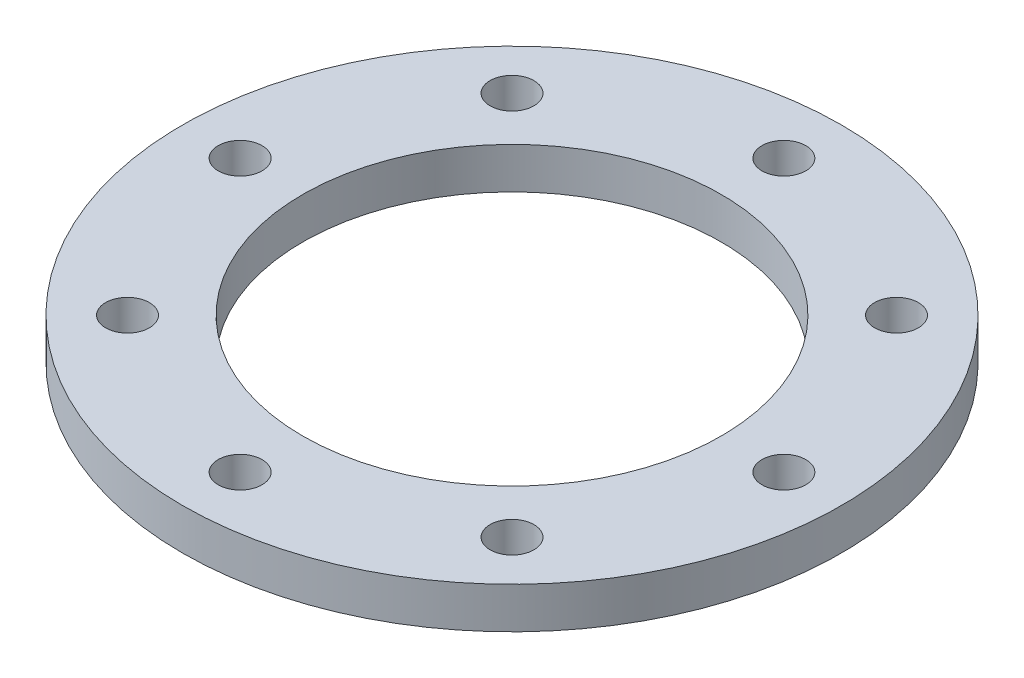
from build123d import *

# Parameters (mm, degrees)
SKETCH1_R               = 50.8
SKETCH1_R_2             = 32.258
BOSS_EXTRUDE1_DEPTH     = 6.35
F_1_4_CLEARANCE_HOLE1_D = 6.7564
CIRPATTERN1_COUNT       = 8


with BuildPart() as part:
    # Sketch1 → Boss-Extrude1 (new body)
    with BuildSketch(Plane(origin=(0, 0, 0), x_dir=(1, 0, 0), z_dir=(0, 1, 0))):
        Circle(SKETCH1_R)
        Circle(SKETCH1_R_2, mode=Mode.SUBTRACT)
    extrude(amount=BOSS_EXTRUDE1_DEPTH)

    # 1/4 Clearance Hole1 (through all)
    with Locations(Plane(origin=(0, 6.35, 0), x_dir=(1, 0, 0), z_dir=(0, 1, 0))):
        with Locations((0, 41.91)):
            f_1_4_clearance_hole1 = Hole(F_1_4_CLEARANCE_HOLE1_D / 2)

    # CirPattern1: 1/4 Clearance Hole1 ×8 about axis
    cirpattern1_axis = Axis((0, 6.35, 0), (0, -1, 0))
    for i in range(1, CIRPATTERN1_COUNT):
        add(f_1_4_clearance_hole1.rotate(cirpattern1_axis, i * 360 / CIRPATTERN1_COUNT), mode=Mode.SUBTRACT)


solid = part.part
